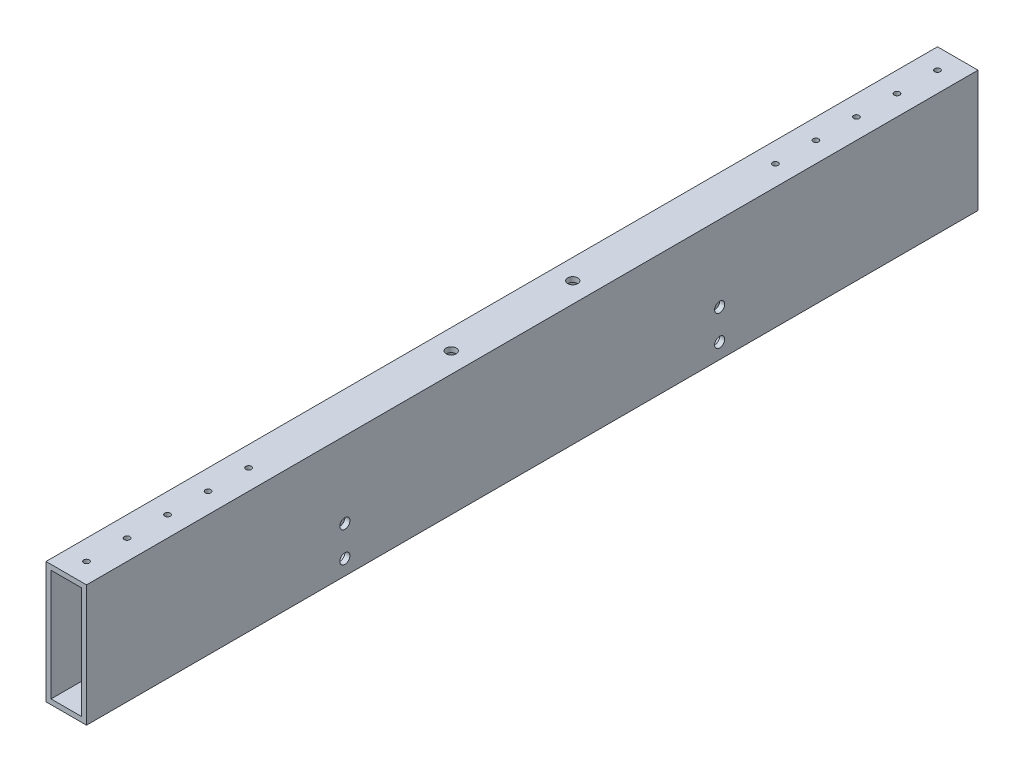
from build123d import *

# Parameters (mm, degrees)
SKETCH1_W                       = 25.4
SKETCH1_H                       = 76.2
SKETCH1_W_2                     = 19.05
SKETCH1_H_2                     = 69.85
BOSS_EXTRUDE1_DEPTH             = 279.4
SKETCH3_R                       = 1.7272
CUT_EXTRUDE2_DEPTH              = 6.35
F_1_4_0_25_DIAMETER_HOLE1_D     = 6.35
F_1_4_0_25_DIAMETER_HOLE1_DEPTH = 25.4
F_1_4_0_25_DIAMETER_HOLE1_TIP   = 1.907732465
F_1_4_0_25_DIAMETER_HOLE2_D     = 6.35
CUT_EXTRUDE4_START              = -6.35
SKETCH2_R                       = 1.7272
CUT_EXTRUDE4_DEPTH              = 6.35


with BuildPart() as part:
    # Sketch1 → Boss-Extrude1 (new, symmetric)
    with BuildSketch(Plane.XY):
        Rectangle(SKETCH1_W, SKETCH1_H)
        Rectangle(SKETCH1_W_2, SKETCH1_H_2, mode=Mode.SUBTRACT)
    extrude(amount=BOSS_EXTRUDE1_DEPTH, both=True)

    # Sketch3 → Cut-Extrude2 (cut)
    with BuildSketch(Plane.XZ.offset(38.1)):
        with Locations((0, 241.3)):
            Circle(SKETCH3_R)
        with Locations((0, 190.5)):
            Circle(SKETCH3_R)
        with Locations((0, 139.7)):
            Circle(SKETCH3_R)
        with Locations((0, 88.9)):
            Circle(SKETCH3_R)
        with Locations((0, 38.1)):
            Circle(SKETCH3_R)
        with Locations((0, -12.7)):
            Circle(SKETCH3_R)
        with Locations((0, -63.5)):
            Circle(SKETCH3_R)
        with Locations((0, -114.3)):
            Circle(SKETCH3_R)
        with Locations((0, -165.1)):
            Circle(SKETCH3_R)
        with Locations((0, -215.9)):
            Circle(SKETCH3_R)
        with Locations((0, -266.7)):
            Circle(SKETCH3_R)
    extrude(amount=-CUT_EXTRUDE2_DEPTH, mode=Mode.SUBTRACT)

    # 1/4 (0.25) Diameter Hole1
    with Locations(Plane.ZY.offset(12.7)):
        with Locations((-117.475, -28.575), (117.475, -28.575), (-117.475, -9.525), (117.475, -9.525)):
            Hole(F_1_4_0_25_DIAMETER_HOLE1_D / 2, depth=F_1_4_0_25_DIAMETER_HOLE1_DEPTH)
            with Locations((0, 0, -(F_1_4_0_25_DIAMETER_HOLE1_DEPTH + F_1_4_0_25_DIAMETER_HOLE1_TIP / 2))):  # 118° drill point
                Cone(0, F_1_4_0_25_DIAMETER_HOLE1_D / 2, F_1_4_0_25_DIAMETER_HOLE1_TIP, mode=Mode.SUBTRACT)

    # 1/4 (0.25) Diameter Hole2 (through all)
    with Locations(Plane(origin=(0, 38.1, 0), x_dir=(1, 0, 0), z_dir=(0, 1, 0))):
        with Locations((0, -38.1), (0, 38.1)):
            Hole(F_1_4_0_25_DIAMETER_HOLE2_D / 2)

    # Sketch2 → Cut-Extrude4 (cut)
    with BuildSketch(Plane(origin=(0, 38.1, 0), x_dir=(1, 0, 0), z_dir=(0, 1, 0)).offset(CUT_EXTRUDE4_START)):
        with Locations((0, 266.7)):
            Circle(SKETCH2_R)
        with Locations((0, 241.3)):
            Circle(SKETCH2_R)
        with Locations((0, 215.9)):
            Circle(SKETCH2_R)
        with Locations((0, 190.5)):
            Circle(SKETCH2_R)
        with Locations((0, 165.1)):
            Circle(SKETCH2_R)
    cut_extrude4 = extrude(amount=CUT_EXTRUDE4_DEPTH, mode=Mode.SUBTRACT)

    # Mirror1: Cut-Extrude4 across plane
    add(cut_extrude4.mirror(Plane.XY), mode=Mode.SUBTRACT)


solid = part.part
